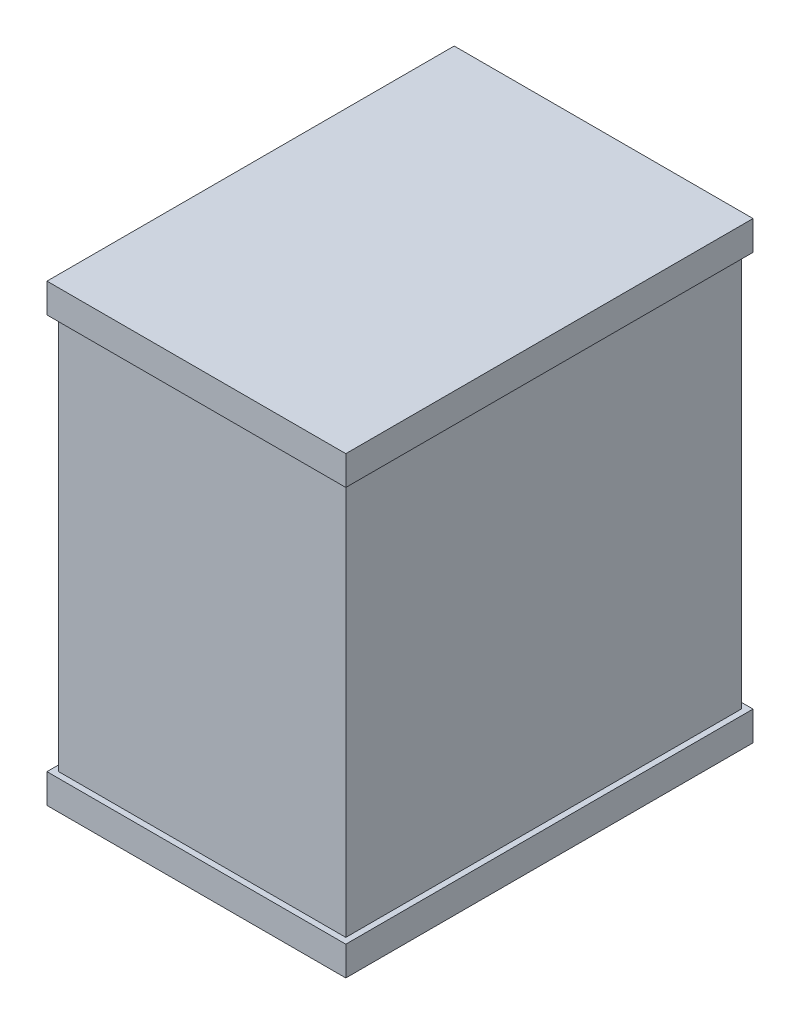
from build123d import *

# Parameters (mm, degrees)
SKETCH_1_W      = 98
SKETCH_1_H      = 155
EXTRUDE_1_DEPTH = 135
SKETCH_4_W      = 102
SKETCH_4_H      = 139
SKETCH_4_W_2    = 98
SKETCH_4_H_2    = 135
EXTRUDE_3_DEPTH = 10
SKETCH_5_W      = 102
SKETCH_5_H      = 139
SKETCH_5_W_2    = 98
SKETCH_5_H_2    = 135
EXTRUDE_4_DEPTH = 10


with BuildPart() as part:
    # 草图1 → 凸台-拉伸1 (new body)
    with BuildSketch(Plane.XY):
        Rectangle(SKETCH_1_W, SKETCH_1_H)
    extrude(amount=EXTRUDE_1_DEPTH)

    # 草图4 → 凸台-拉伸3 (add)
    with BuildSketch(Plane(origin=(0, 77.5, 0), x_dir=(1, 0, 0), z_dir=(0, 1, 0))):
        with Locations((0, -67.5)):
            Rectangle(SKETCH_4_W, SKETCH_4_H)
        with Locations((0, -67.5)):
            Rectangle(SKETCH_4_W_2, SKETCH_4_H_2, mode=Mode.SUBTRACT)
    extrude(amount=-EXTRUDE_3_DEPTH)

    # 草图5 → 凸台-拉伸4 (add)
    with BuildSketch(Plane.XZ.offset(77.5)):
        with Locations((0, 67.5)):
            Rectangle(SKETCH_5_W, SKETCH_5_H)
        with Locations((0, 67.5)):
            Rectangle(SKETCH_5_W_2, SKETCH_5_H_2, mode=Mode.SUBTRACT)
    extrude(amount=-EXTRUDE_4_DEPTH)


solid = part.part
